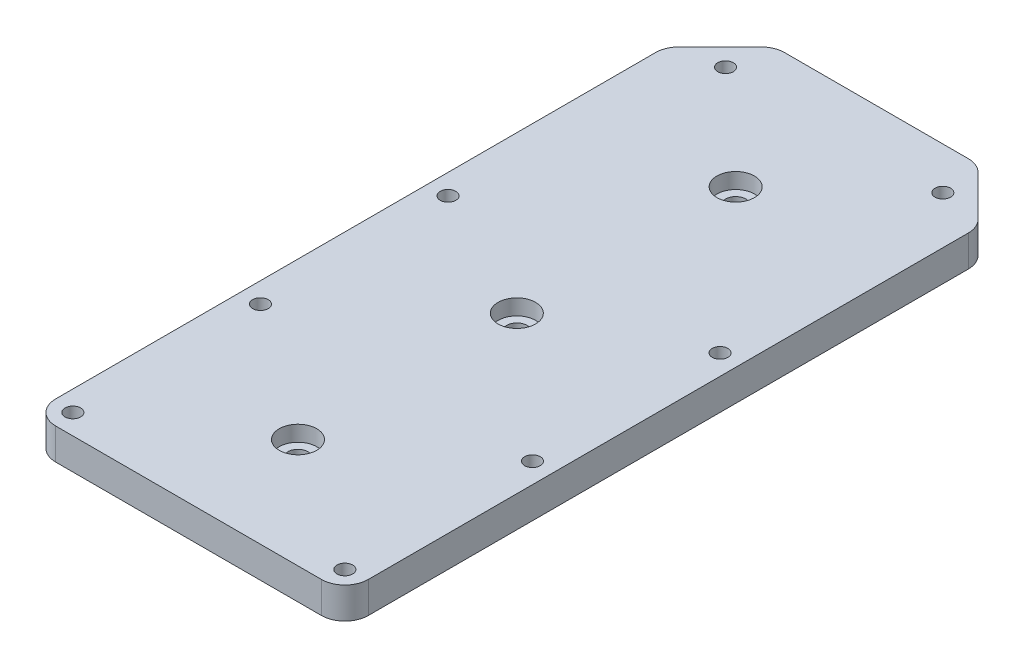
from build123d import *

# Parameters (mm, degrees)
SKETCH1_R           = 2.5
SKETCH1_R_2         = 3.25
BOSS_EXTRUDE1_DEPTH = 10
SKETCH2_R           = 6
CUT_EXTRUDE1_DEPTH  = 5
FILLET1_R           = 7.5


with BuildPart() as part:
    # Sketch1 → Boss-Extrude1 (new body)
    with BuildSketch(Plane(origin=(0, 0, 0), x_dir=(1, 0, 0), z_dir=(0, 1, 0))):
        Polygon((-25.074257426, 57.194719472), (-42.574257426, 39.694719472), (-42.574257426, -162.805280528), (57.425742574, -162.805280528), (57.425742574, 39.694719472), (39.925742574, 57.194719472), align=None)
        with Locations((-36.074257426, -156.305280528)):
            Circle(SKETCH1_R, mode=Mode.SUBTRACT)
        with Locations((-36.074257426, -96.305280528)):
            Circle(SKETCH1_R, mode=Mode.SUBTRACT)
        with Locations((7.425742574, -127.805280528)):
            Circle(SKETCH1_R_2, mode=Mode.SUBTRACT)
        with Locations((50.925742574, -156.305280528)):
            Circle(SKETCH1_R, mode=Mode.SUBTRACT)
        with Locations((7.425742574, -57.805280528)):
            Circle(SKETCH1_R_2, mode=Mode.SUBTRACT)
        with Locations((50.925742574, -96.305280528)):
            Circle(SKETCH1_R, mode=Mode.SUBTRACT)
        with Locations((-36.074257426, -36.305280528)):
            Circle(SKETCH1_R, mode=Mode.SUBTRACT)
        with Locations((-27.324257426, 43.694719472)):
            Circle(SKETCH1_R, mode=Mode.SUBTRACT)
        with Locations((50.925742574, -36.305280528)):
            Circle(SKETCH1_R, mode=Mode.SUBTRACT)
        with Locations((7.425742574, 12.194719472)):
            Circle(SKETCH1_R_2, mode=Mode.SUBTRACT)
        with Locations((42.175742574, 43.694719472)):
            Circle(SKETCH1_R, mode=Mode.SUBTRACT)
    extrude(amount=BOSS_EXTRUDE1_DEPTH)

    # Sketch2 → Cut-Extrude1 (cut)
    with BuildSketch(Plane(origin=(0, 10, 0), x_dir=(1, 0, 0), z_dir=(0, 1, 0))):
        with Locations((7.425742574, 12.194719472)):
            Circle(SKETCH2_R)
        with Locations((7.425742574, -57.805280528)):
            Circle(SKETCH2_R)
        with Locations((7.425742574, -127.805280528)):
            Circle(SKETCH2_R)
    extrude(amount=-CUT_EXTRUDE1_DEPTH, mode=Mode.SUBTRACT)

    # Fillet1
    fillet1_edges = [part.edges().sort_by_distance(p)[0] for p in [
        (57.425742574, 5, 162.805280528),
        (-42.574257426, 5, 162.805280528),
        (-42.574257426, 5, -39.694719472),
        (-25.074257426, 5, -57.194719472),
        (57.425742574, 5, -39.694719472),
        (39.925742574, 5, -57.194719472),
    ]]
    fillet(fillet1_edges, radius=FILLET1_R)


solid = part.part
